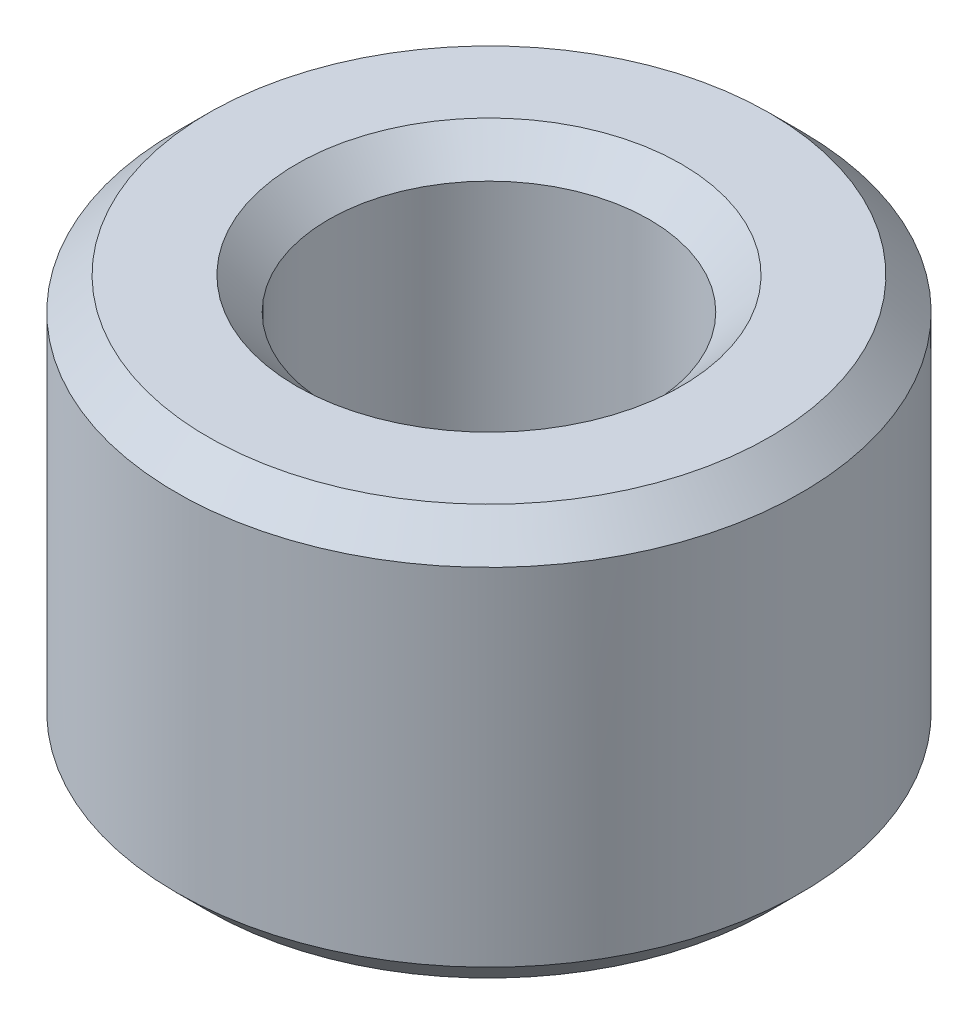
from build123d import *

# Parameters (mm, degrees)
SKETCH1_R           = 32.5
BOSS_EXTRUDE1_DEPTH = 42.646756403
SKETCH2_R           = 16.66887752
CUT_EXTRUDE1_DEPTH  = 63.69964778
CHAMFER1_SIZE       = 3.328568485


with BuildPart() as part:
    # Sketch1 → Boss-Extrude1 (new body)
    with BuildSketch(Plane(origin=(0, 0, 0), x_dir=(1, 0, 0), z_dir=(0, 1, 0))):
        Circle(SKETCH1_R)
    extrude(amount=BOSS_EXTRUDE1_DEPTH)

    # Sketch2 → Cut-Extrude1 (cut, through all)
    with BuildSketch(Plane(origin=(0, 0, 0), x_dir=(1, 0, 0), z_dir=(0, 1, 0))):
        Circle(SKETCH2_R)
    extrude(amount=CUT_EXTRUDE1_DEPTH, mode=Mode.SUBTRACT)

    # Chamfer1
    chamfer1_edges = [part.edges().sort_by_distance(p)[0] for p in [
        (-16.66887752, 42.646756403, 0),
        (-16.66887752, 0, 0),
        (-32.5, 0, 0),
        (-32.5, 42.646756403, 0),
    ]]
    chamfer(chamfer1_edges, length=CHAMFER1_SIZE)


solid = part.part
